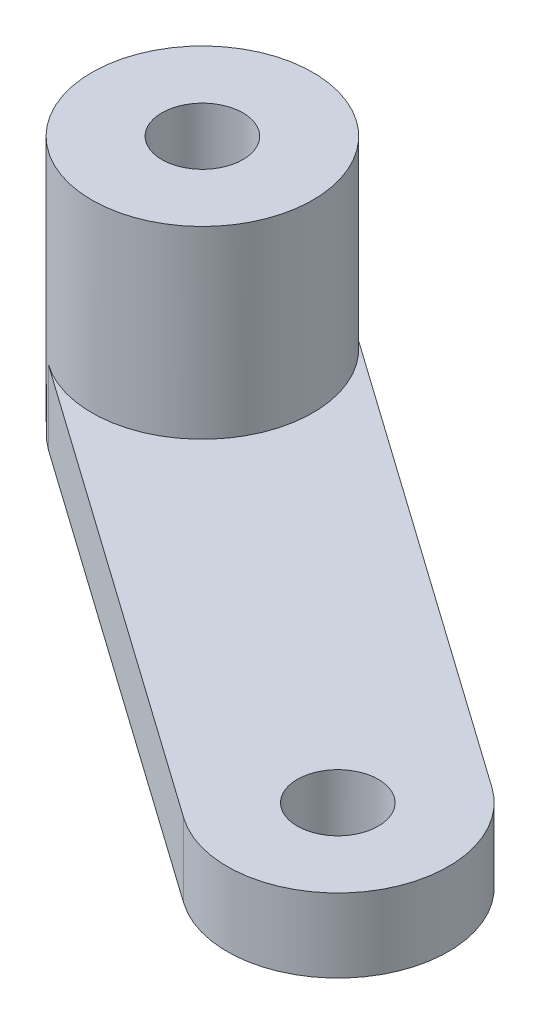
from build123d import *
from build123d.topology import SkipClean

# Parameters (mm, degrees)
BOSS_EXTRUDE1_DEPTH = 2
SKETCH2_R           = 3
SKETCH2_R_2         = 1.1
BOSS_EXTRUDE2_DEPTH = 5
SKETCH4_R           = 1.1
CUT_EXTRUDE1_DEPTH  = 5


with BuildPart() as part:
    # Sketch1 → Boss-Extrude1 (new body)
    with BuildSketch(Plane(origin=(0, 0, 0), x_dir=(1, 0, 0), z_dir=(0, 1, 0))):
        with BuildLine():
            Line((-15.769757973, 16.275767743), (-3.269757973, 7.450767743))
            ThreePointArc((-3.269757973, 7.450767743), (-2.549232257, 3.269757973), (-6.730242027, 2.549232257))
            Line((-6.730242027, 2.549232257), (-19.230242027, 11.374232257))
            ThreePointArc((-19.230242027, 11.374232257), (-19.950767743, 15.555242027), (-15.769757973, 16.275767743))
        make_face()
    extrude(amount=BOSS_EXTRUDE1_DEPTH)

    # Sketch2 → Boss-Extrude2 (add)
    with SkipClean():  # the faces are left unmerged after this step: merging them gives an invalid solid
        with BuildSketch(Plane(origin=(0, 2, 0), x_dir=(1, 0, 0), z_dir=(0, 1, 0))):
            with Locations((-17.5, 13.825)):
                Circle(SKETCH2_R)
            with Locations((-17.5, 13.825)):
                Circle(SKETCH2_R_2, mode=Mode.SUBTRACT)
        extrude(amount=BOSS_EXTRUDE2_DEPTH)

    # Sketch4 → Cut-Extrude1 (cut)
    with SkipClean():  # the faces are left unmerged after this step: merging them gives an invalid solid
        with BuildSketch(Plane.XZ):
            with Locations((-5, -5)):
                Circle(SKETCH4_R)
            with Locations((-17.5, -13.825)):
                Circle(SKETCH4_R)
        extrude(amount=-CUT_EXTRUDE1_DEPTH, mode=Mode.SUBTRACT)


solid = part.part
